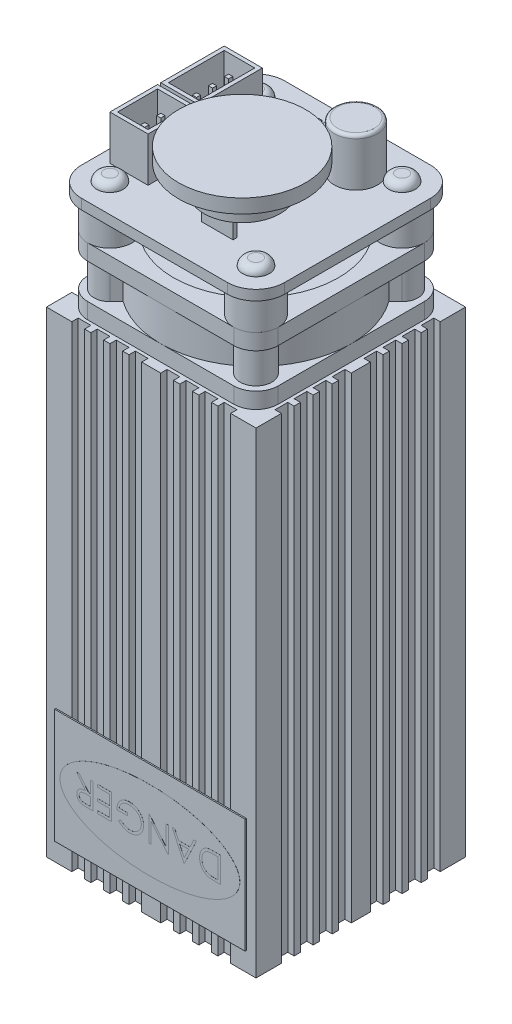
from build123d import *

# Parameters (mm, degrees)
SKETCH1_R              = 8
SKETCH1_R_2            = 2.5
BOSS_EXTRUDE1_DEPTH    = 5.5
SKETCH2_R              = 4
BOSS_EXTRUDE2_DEPTH    = 2
SKETCH3_R              = 9
BOSS_EXTRUDE3_DEPTH    = 75
SKETCH4_R              = 9
BOSS_EXTRUDE4_DEPTH    = 2
FILLET1_R              = 0.5
BOSS_EXTRUDE5_DEPTH    = 2.5
BOSS_EXTRUDE6_DEPTH    = 5.5
BOSS_EXTRUDE7_DEPTH    = 2.5
SKETCH9_R              = 3.5
BOSS_EXTRUDE8_DEPTH    = 5
BOSS_EXTRUDE8_2_DEPTH  = 5
BOSS_EXTRUDE8_3_DEPTH  = 5
BOSS_EXTRUDE8_4_DEPTH  = 5
BOSS_EXTRUDE9_DEPTH    = 1.6
SKETCH11_R             = 13
CUT_EXTRUDE1_DEPTH     = 1.6
SKETCH12_W             = 6
SKETCH12_H             = 10
SKETCH12_W_2           = 4.8
SKETCH12_H_2           = 8.8
SKETCH12_H_3           = 7.5
SKETCH12_H_4           = 6.3
BOSS_EXTRUDE10_DEPTH   = 7
SKETCH13_W             = 0.65
SKETCH13_H             = 0.65
BOSS_EXTRUDE11_DEPTH   = 5.5
SKETCH14_R             = 3.4
BOSS_EXTRUDE12_DEPTH   = 7.5
FILLET2_R              = 0.5
SKETCH15_W             = 5.8
SKETCH15_H             = 5
BOSS_EXTRUDE13_DEPTH   = 2.5
SKETCH16_W             = 0.5
SKETCH16_H             = 3.5
BOSS_EXTRUDE14_DEPTH   = 0.6
BOSS_EXTRUDE14_2_DEPTH = 0.6
BOSS_EXTRUDE14_3_DEPTH = 0.6
BOSS_EXTRUDE14_4_DEPTH = 0.6
BOSS_EXTRUDE14_5_DEPTH = 0.6
SKETCH16_W_2           = 4.454418676
SKETCH16_H_2           = 1.300822907
BOSS_EXTRUDE14_6_DEPTH = 0.6
SKETCH17_R             = 2.1
BOSS_EXTRUDE15_DEPTH   = 1.15
FILLET3_R              = 1.15
SKETCH19_W             = 5
SKETCH19_H             = 0.6
SKETCH19_W_2           = 0.6
SKETCH19_H_2           = 1.4
BOSS_EXTRUDE16_DEPTH   = 3
SKETCH20_R             = 6.011955252
BOSS_EXTRUDE17_DEPTH   = 4
SKETCH21_R             = 10
BOSS_EXTRUDE18_DEPTH   = 2.2
SKETCH22_R             = 1.35
CUT_EXTRUDE3_DEPTH     = 5
SKETCH23_W             = 30
SKETCH23_H             = 18
BOSS_EXTRUDE19_DEPTH   = 0.2
SKETCH24_RX            = 14.161981517
SKETCH24_RY            = 6.24923691
BOSS_EXTRUDE20_DEPTH   = 0.01
BOSS_EXTRUDE21_DEPTH   = 0.01


# Read off the part's stored shape, not the designer's step: CirPattern1
with BuildPart() as part:
    # Sketch1 → Boss-Extrude1 (new body)
    with BuildSketch(Plane(origin=(0, 0, 0), x_dir=(1, 0, 0), z_dir=(0, 1, 0))):
        with Locations(Location((0, 0, 0), (0, 0, 270))):
            Circle(SKETCH1_R)
        with Locations(Location((0, 0, 0), (0, 0, 270))):
            Circle(SKETCH1_R_2, mode=Mode.SUBTRACT)
    extrude(amount=BOSS_EXTRUDE1_DEPTH)

    # Sketch2 → Boss-Extrude2 (add)
    with BuildSketch(Plane(origin=(0, 5.5, 0), x_dir=(1, 0, 0), z_dir=(0, 1, 0))):
        with Locations(Location((0, 0, 0), (0, 0, 270))):
            Circle(SKETCH2_R)
    extrude(amount=BOSS_EXTRUDE2_DEPTH)


with BuildPart() as body_2:
    # Sketch3 → Boss-Extrude3 (new body)
    with BuildSketch(Plane(origin=(0, 7.5, 0), x_dir=(1, 0, 0), z_dir=(0, 1, 0))):
        Polygon((-16.5, 10.5), (-16.5, 9.5), (-15.5, 9.5), (-15.5, 7.5), (-16.5, 7.5), (-16.5, 6.5), (-15.5, 6.5), (-15.5, 4.5), (-16.5, 4.5), (-16.5, 3.5), (-15.5, 3.5), (-15.5, 1.5), (-16.5, 1.5), (-16.5, -1.5), (-15.5, -1.5), (-15.5, -3.5), (-16.5, -3.5), (-16.5, -4.5), (-15.5, -4.5), (-15.5, -6.5), (-16.5, -6.5), (-16.5, -7.5), (-15.5, -7.5), (-15.5, -9.5), (-16.5, -9.5), (-16.5, -10.5), (-15.5, -10.5), (-15.5, -12.5), (-16.5, -12.5), (-16.5, -16.5), (-12.5, -16.5), (-12.5, -15.5), (-10.5, -15.5), (-10.5, -16.5), (-9.5, -16.5), (-9.5, -15.5), (-7.5, -15.5), (-7.5, -16.5), (-6.5, -16.5), (-6.5, -15.5), (-4.5, -15.5), (-4.5, -16.5), (-3.5, -16.5), (-3.5, -15.5), (-1.5, -15.5), (-1.5, -16.5), (1.5, -16.5), (1.5, -15.5), (3.5, -15.5), (3.5, -16.5), (4.5, -16.5), (4.5, -15.5), (6.5, -15.5), (6.5, -16.5), (7.5, -16.5), (7.5, -15.5), (9.5, -15.5), (9.5, -16.5), (10.5, -16.5), (10.5, -15.5), (12.5, -15.5), (12.5, -16.5), (16.5, -16.5), (16.5, -12.5), (15.5, -12.5), (15.5, -10.5), (16.5, -10.5), (16.5, -9.5), (15.5, -9.5), (15.5, -7.5), (16.5, -7.5), (16.5, -6.5), (15.5, -6.5), (15.5, -4.5), (16.5, -4.5), (16.5, -3.5), (15.5, -3.5), (15.5, -1.5), (16.5, -1.5), (16.5, 1.5), (15.5, 1.5), (15.5, 3.5), (16.5, 3.5), (16.5, 4.5), (15.5, 4.5), (15.5, 6.5), (16.5, 6.5), (16.5, 7.5), (15.5, 7.5), (15.5, 9.5), (16.5, 9.5), (16.5, 10.5), (15.5, 10.5), (15.5, 12.5), (16.5, 12.5), (16.5, 16.5), (-16.5, 16.5), (-16.5, 12.5), (-15.5, 12.5), (-15.5, 10.5), align=None)
        with BuildLine():
            Line((13.5, 10.767949192), (13.5, 1.5))
            Line((13.5, 1.5), (11.9058809, 1.5))
            ThreePointArc((11.9058809, 1.5), (8.485281374, 8.485281374), (1.5, 11.9058809))
            Line((1.5, 11.9058809), (1.5, 13.5))
            Line((1.5, 13.5), (10.767949192, 13.5))
            ThreePointArc((10.767949192, 13.5), (10.534687206, 12.870871435), (10.522628007, 12.2))
            Line((10.522628007, 12.2), (11.546060799, 12.2))
            ThreePointArc((11.546060799, 12.2), (13.207106781, 13.207106781), (12.2, 11.546060799))
            Line((12.2, 11.546060799), (12.2, 10.522628007))
            ThreePointArc((12.2, 10.522628007), (12.870871435, 10.534687206), (13.5, 10.767949192))
        make_face(mode=Mode.SUBTRACT)
        with BuildLine():
            ThreePointArc((-1.5, 11.9058809), (-8.485281374, 8.485281374), (-11.9058809, 1.5))
            Line((-11.9058809, 1.5), (-13.5, 1.5))
            Line((-13.5, 1.5), (-13.5, 10.767949192))
            ThreePointArc((-13.5, 10.767949192), (-12.870871435, 10.534687206), (-12.2, 10.522628007))
            Line((-12.2, 10.522628007), (-12.2, 11.546060799))
            ThreePointArc((-12.2, 11.546060799), (-13.207106781, 13.207106781), (-11.546060799, 12.2))
            Line((-11.546060799, 12.2), (-10.522628007, 12.2))
            ThreePointArc((-10.522628007, 12.2), (-10.534687206, 12.870871435), (-10.767949192, 13.5))
            Line((-10.767949192, 13.5), (-1.5, 13.5))
            Line((-1.5, 13.5), (-1.5, 11.9058809))
        make_face(mode=Mode.SUBTRACT)
        with BuildLine():
            ThreePointArc((-11.9058809, -1.5), (-8.485281374, -8.485281374), (-1.5, -11.9058809))
            Line((-1.5, -11.9058809), (-1.5, -13.5))
            Line((-1.5, -13.5), (-10.767949192, -13.5))
            ThreePointArc((-10.767949192, -13.5), (-10.534687206, -12.870871435), (-10.522628007, -12.2))
            Line((-10.522628007, -12.2), (-11.546060799, -12.2))
            ThreePointArc((-11.546060799, -12.2), (-13.207106781, -13.207106781), (-12.2, -11.546060799))
            Line((-12.2, -11.546060799), (-12.2, -10.522628007))
            ThreePointArc((-12.2, -10.522628007), (-12.870871435, -10.534687206), (-13.5, -10.767949192))
            Line((-13.5, -10.767949192), (-13.5, -1.5))
            Line((-13.5, -1.5), (-11.9058809, -1.5))
        make_face(mode=Mode.SUBTRACT)
        with BuildLine():
            ThreePointArc((1.5, -11.9058809), (8.485281374, -8.485281374), (11.9058809, -1.5))
            Line((11.9058809, -1.5), (13.5, -1.5))
            Line((13.5, -1.5), (13.5, -10.767949192))
            ThreePointArc((13.5, -10.767949192), (12.870871435, -10.534687206), (12.2, -10.522628007))
            Line((12.2, -10.522628007), (12.2, -11.546060799))
            ThreePointArc((12.2, -11.546060799), (13.207106781, -13.207106781), (11.546060799, -12.2))
            Line((11.546060799, -12.2), (10.522628007, -12.2))
            ThreePointArc((10.522628007, -12.2), (10.534687206, -12.870871435), (10.767949192, -13.5))
            Line((10.767949192, -13.5), (1.5, -13.5))
            Line((1.5, -13.5), (1.5, -11.9058809))
        make_face(mode=Mode.SUBTRACT)
        with Locations(Location((0, 0, 0), (0, 0, 270))):
            Circle(SKETCH3_R, mode=Mode.SUBTRACT)
    extrude(amount=BOSS_EXTRUDE3_DEPTH)

    # Sketch5 → Boss-Extrude5 (add)
    with BuildSketch(Plane(origin=(0, 82.5, 0), x_dir=(1, 0, 0), z_dir=(0, 1, 0))):
        with BuildLine():
            Line((-11.5, -15), (11.5, -15))
            ThreePointArc((11.5, -15), (13.974873734, -13.974873734), (15, -11.5))
            Line((15, -11.5), (15, 11.5))
            ThreePointArc((15, 11.5), (13.974873734, 13.974873734), (11.5, 15))
            Line((11.5, 15), (-11.5, 15))
            ThreePointArc((-11.5, 15), (-13.974873734, 13.974873734), (-15, 11.5))
            Line((-15, 11.5), (-15, -11.5))
            ThreePointArc((-15, -11.5), (-13.974873734, -13.974873734), (-11.5, -15))
        make_face()
    extrude(amount=BOSS_EXTRUDE5_DEPTH)

    # Sketch6 → Boss-Extrude6 (add)
    with BuildSketch(Plane(origin=(0, 85, 0), x_dir=(1, 0, 0), z_dir=(0, 1, 0))):
        with BuildLine():
            Line((-13.267766953, 9.732233047), (-12.226017285, 8.690483379))
            ThreePointArc((-12.226017285, 8.690483379), (-15, 0), (-12.226017285, -8.690483379))
            Line((-12.226017285, -8.690483379), (-13.267766953, -9.732233047))
            ThreePointArc((-13.267766953, -9.732233047), (-13.267766953, -13.267766953), (-9.732233047, -13.267766953))
            Line((-9.732233047, -13.267766953), (-8.690483379, -12.226017285))
            ThreePointArc((-8.690483379, -12.226017285), (0, -15), (8.690483379, -12.226017285))
            Line((8.690483379, -12.226017285), (9.732233047, -13.267766953))
            ThreePointArc((9.732233047, -13.267766953), (13.267766953, -13.267766953), (13.267766953, -9.732233047))
            Line((13.267766953, -9.732233047), (12.226017285, -8.690483379))
            ThreePointArc((12.226017285, -8.690483379), (15, 0), (12.226017285, 8.690483379))
            Line((12.226017285, 8.690483379), (13.267766953, 9.732233047))
            ThreePointArc((13.267766953, 9.732233047), (13.267766953, 13.267766953), (9.732233047, 13.267766953))
            Line((9.732233047, 13.267766953), (8.690483379, 12.226017285))
            ThreePointArc((8.690483379, 12.226017285), (0, 15), (-8.690483379, 12.226017285))
            Line((-8.690483379, 12.226017285), (-9.732233047, 13.267766953))
            ThreePointArc((-9.732233047, 13.267766953), (-13.267766953, 13.267766953), (-13.267766953, 9.732233047))
        make_face()
    extrude(amount=BOSS_EXTRUDE6_DEPTH)

    # Sketch22 → Cut-Extrude3 (cut)
    with BuildSketch(Plane(origin=(0, 0, -16.5), x_dir=(-1, 0, 0), z_dir=(0, 0, -1))):
        with Locations((0, 15.5)):
            Circle(SKETCH22_R)
        with Locations((0, 23)):
            Circle(SKETCH22_R)
        with Locations((0, 43)):
            Circle(SKETCH22_R)
        with Locations((0, 55.5)):
            Circle(SKETCH22_R)
    extrude(amount=-CUT_EXTRUDE3_DEPTH, mode=Mode.SUBTRACT)


with BuildPart() as body_3:
    # Sketch4 → Boss-Extrude4 (new body)
    with BuildSketch(Plane(origin=(0, 7.5, 0), x_dir=(1, 0, 0), z_dir=(0, 1, 0))):
        with Locations(Location((0, 0, 0), (0, 0, 270))):
            Circle(SKETCH4_R)
    extrude(amount=BOSS_EXTRUDE4_DEPTH)

    # Fillet1
    fillet1_edges = [body_3.edges().sort_by_distance(p)[0] for p in [
        (0, 7.5, -9),
    ]]
    fillet(fillet1_edges, radius=FILLET1_R)


with BuildPart() as body_4:
    # Sketch7 → Boss-Extrude7 (new body)
    with BuildSketch(Plane(origin=(0, 90.5, 0), x_dir=(1, 0, 0), z_dir=(0, 1, 0))):
        with BuildLine():
            Line((-11.5, -15), (11.5, -15))
            ThreePointArc((11.5, -15), (13.974873734, -13.974873734), (15, -11.5))
            Line((15, -11.5), (15, 11.5))
            ThreePointArc((15, 11.5), (13.974873734, 13.974873734), (11.5, 15))
            Line((11.5, 15), (-11.5, 15))
            ThreePointArc((-11.5, 15), (-13.974873734, 13.974873734), (-15, 11.5))
            Line((-15, 11.5), (-15, -11.5))
            ThreePointArc((-15, -11.5), (-13.974873734, -13.974873734), (-11.5, -15))
        make_face()
    extrude(amount=BOSS_EXTRUDE7_DEPTH)

    # Sketch11 → Cut-Extrude1 (cut)
    with BuildSketch(Plane(origin=(0, 93, 0), x_dir=(1, 0, 0), z_dir=(0, 1, 0))):
        with Locations(Location((0, 0, 0), (0, 0, 270))):
            Circle(SKETCH11_R)
    extrude(amount=-CUT_EXTRUDE1_DEPTH, mode=Mode.SUBTRACT)


with BuildPart() as body_5:
    # Sketch9 → Boss-Extrude8 (new body)
    with BuildSketch(Plane(origin=(0, 93, 0), x_dir=(1, 0, 0), z_dir=(0, 1, 0))):
        with Locations(Location((-11.5, 11.5, 0), (0, 0, 270))):
            Circle(SKETCH9_R)
    extrude(amount=BOSS_EXTRUDE8_DEPTH)


with BuildPart() as body_6:
    # Sketch9 → Boss-Extrude8 2 (new body)
    with BuildSketch(Plane(origin=(0, 93, 0), x_dir=(1, 0, 0), z_dir=(0, 1, 0))):
        with Locations(Location((11.5, 11.5, 0), (0, 0, 270))):
            Circle(SKETCH9_R)
    extrude(amount=BOSS_EXTRUDE8_2_DEPTH)


with BuildPart() as body_7:
    # Sketch9 → Boss-Extrude8 3 (new body)
    with BuildSketch(Plane(origin=(0, 93, 0), x_dir=(1, 0, 0), z_dir=(0, 1, 0))):
        with Locations(Location((11.5, -11.5, 0), (0, 0, 270))):
            Circle(SKETCH9_R)
    extrude(amount=BOSS_EXTRUDE8_3_DEPTH)


with BuildPart() as body_8:
    # Sketch9 → Boss-Extrude8 4 (new body)
    with BuildSketch(Plane(origin=(0, 93, 0), x_dir=(1, 0, 0), z_dir=(0, 1, 0))):
        with Locations(Location((-11.5, -11.5, 0), (0, 0, 270))):
            Circle(SKETCH9_R)
    extrude(amount=BOSS_EXTRUDE8_4_DEPTH)


with BuildPart() as body_9:
    # Sketch10 → Boss-Extrude9 (new body)
    with BuildSketch(Plane(origin=(0, 98, 0), x_dir=(1, 0, 0), z_dir=(0, 1, 0))):
        with BuildLine():
            Line((11.5, 16), (-11.5, 16))
            ThreePointArc((-11.5, 16), (-14.681980515, 14.681980515), (-16, 11.5))
            Line((-16, 11.5), (-16, -11.5))
            ThreePointArc((-16, -11.5), (-14.681980515, -14.681980515), (-11.5, -16))
            Line((-11.5, -16), (11.5, -16))
            ThreePointArc((11.5, -16), (14.681980515, -14.681980515), (16, -11.5))
            Line((16, -11.5), (16, 11.5))
            ThreePointArc((16, 11.5), (14.681980515, 14.681980515), (11.5, 16))
        make_face()
    extrude(amount=BOSS_EXTRUDE9_DEPTH)

    # Sketch12 → Boss-Extrude10 (add)
    # profile 1 of 2: a face of its own
    with BuildSketch(Plane(origin=(0, 99.6, 0), x_dir=(1, 0, 0), z_dir=(0, 1, 0))):
        with Locations((-11, 4)):
            Rectangle(SKETCH12_W, SKETCH12_H)
        with Locations((-11, 4)):
            Rectangle(SKETCH12_W_2, SKETCH12_H_2, mode=Mode.SUBTRACT)
    # profile 2 of 2: a face of its own
    with BuildSketch(Plane(origin=(0, 99.6, 0), x_dir=(1, 0, 0), z_dir=(0, 1, 0))):
        with Locations((-11, -5.25)):
            Rectangle(SKETCH12_W, SKETCH12_H_3)
        with Locations((-11, -5.25)):
            Rectangle(SKETCH12_W_2, SKETCH12_H_4, mode=Mode.SUBTRACT)
    extrude(amount=BOSS_EXTRUDE10_DEPTH)

    # Sketch13 → Boss-Extrude11 (add)
    with BuildSketch(Plane(origin=(0, 99.6, 0), x_dir=(1, 0, 0), z_dir=(0, 1, 0))):
        with Locations((-11, 6.69)):
            Rectangle(SKETCH13_W, SKETCH13_H)
        with Locations((-11, 4.16)):
            Rectangle(SKETCH13_W, SKETCH13_H)
        with Locations((-11, 1.63)):
            Rectangle(SKETCH13_W, SKETCH13_H)
        with Locations((-11, -3.985)):
            Rectangle(SKETCH13_W, SKETCH13_H)
        with Locations((-11, -6.515)):
            Rectangle(SKETCH13_W, SKETCH13_H)
    extrude(amount=BOSS_EXTRUDE11_DEPTH)

    # Sketch14 → Boss-Extrude12 (add)
    with BuildSketch(Plane(origin=(0, 99.6, 0), x_dir=(1, 0, 0), z_dir=(0, 1, 0))):
        with Locations(Location((6.6343548, 9.108581093, 0), (0, 0, 270))):
            Circle(SKETCH14_R)
    extrude(amount=BOSS_EXTRUDE12_DEPTH)

    # Fillet2
    fillet2_edges = [body_9.edges().sort_by_distance(p)[0] for p in [
        (6.6343548, 107.1, -12.508581093),
    ]]
    fillet(fillet2_edges, radius=FILLET2_R)

    # Sketch17 → Boss-Extrude15 (add)
    with BuildSketch(Plane(origin=(0, 99.6, 0), x_dir=(1, 0, 0), z_dir=(0, 1, 0))):
        with Locations(Location((-11.5, -11.5, 0), (0, 0, 270))):
            Circle(SKETCH17_R)
    extrude(amount=BOSS_EXTRUDE15_DEPTH)

    # Fillet3
    fillet3_edges = [body_9.edges().sort_by_distance(p)[0] for p in [
        (-11.5, 100.75, 9.4),
    ]]
    fillet(fillet3_edges, radius=FILLET3_R - 0.0001)  # a hair under: the kernel refuses the full size

    # CirPattern1 outline → CirPattern1 (revolve)
    with BuildSketch(Plane(origin=(-11.5, 0, -11.5), x_dir=(1, 0, 0), z_dir=(0, 0, 1))):
        with BuildLine():
            Line((0.95, 100.75), (0, 100.75))
            Line((0, 100.75), (0, 99.6))
            Line((0, 99.6), (2.1, 99.6))
            ThreePointArc((2.1, 99.6), (1.763172798, 100.413172798), (0.95, 100.75))
        make_face()
    revolve(axis=Axis((-11.5, 0, -11.5), (0, 1, 0)))

    # CirPattern1 2 outline → CirPattern1 2 (revolve)
    with BuildSketch(Plane(origin=(11.5, 0, -11.5), x_dir=(1, 0, 0), z_dir=(0, 0, 1))):
        with BuildLine():
            Line((0.95, 100.75), (0, 100.75))
            Line((0, 100.75), (0, 99.6))
            Line((0, 99.6), (2.1, 99.6))
            ThreePointArc((2.1, 99.6), (1.763172798, 100.413172798), (0.95, 100.75))
        make_face()
    revolve(axis=Axis((11.5, 0, -11.5), (0, 1, 0)))

    # CirPattern1 3 outline → CirPattern1 3 (revolve)
    with BuildSketch(Plane(origin=(11.5, 0, 11.5), x_dir=(1, 0, 0), z_dir=(0, 0, 1))):
        with BuildLine():
            Line((0.95, 100.75), (0, 100.75))
            Line((0, 100.75), (0, 99.6))
            Line((0, 99.6), (2.1, 99.6))
            ThreePointArc((2.1, 99.6), (1.763172798, 100.413172798), (0.95, 100.75))
        make_face()
    revolve(axis=Axis((11.5, 0, 11.5), (0, 1, 0)))

    # Sketch19 → Boss-Extrude16 (add)
    with BuildSketch(Plane(origin=(0, 99.6, 0), x_dir=(1, 0, 0), z_dir=(0, 1, 0))):
        with Locations((3.631562842, -1.508021858)):
            Rectangle(SKETCH19_W, SKETCH19_H)
        with Locations((3.631562842, -9.448218579)):
            Rectangle(SKETCH19_W, SKETCH19_H)
        with Locations((-1.193278944, -3.51449095)):
            Rectangle(SKETCH19_W_2, SKETCH19_H_2)
        with Locations((-1.193278944, -6.885189757)):
            Rectangle(SKETCH19_W_2, SKETCH19_H_2)
    extrude(amount=BOSS_EXTRUDE16_DEPTH)

    # Sketch20 → Boss-Extrude17 (add)
    with BuildSketch(Plane(origin=(0, 102.6, 0), x_dir=(1, 0, 0), z_dir=(0, 1, 0))):
        with Locations(Location((3.262251366, -5.447344262, 0), (0, 0, 270))):
            Circle(SKETCH20_R)
    extrude(amount=BOSS_EXTRUDE17_DEPTH)

    # Sketch21 → Boss-Extrude18 (add)
    with BuildSketch(Plane(origin=(0, 106.6, 0), x_dir=(1, 0, 0), z_dir=(0, 1, 0))):
        with Locations(Location((3.262251366, -5.447344262, 0), (0, 0, 270))):
            Circle(SKETCH21_R)
    extrude(amount=BOSS_EXTRUDE18_DEPTH)


with BuildPart() as body_10:
    # Sketch15 → Boss-Extrude13 (new body)
    with BuildSketch(Plane(origin=(0, 99.6, 0), x_dir=(1, 0, 0), z_dir=(0, 1, 0))):
        with Locations((-2.886204419, 6.964801259)):
            Rectangle(SKETCH15_W, SKETCH15_H)
    extrude(amount=BOSS_EXTRUDE13_DEPTH)


with BuildPart() as body_11:
    # Sketch16 → Boss-Extrude14 (new body)
    with BuildSketch(Plane(origin=(0, 99.6, 0), x_dir=(1, 0, 0), z_dir=(0, 1, 0))):
        with Locations((-4.847374416, 11.214801259)):
            Rectangle(SKETCH16_W, SKETCH16_H)
    extrude(amount=BOSS_EXTRUDE14_DEPTH)


with BuildPart() as body_12:
    # Sketch16 → Boss-Extrude14 2 (new body)
    with BuildSketch(Plane(origin=(0, 99.6, 0), x_dir=(1, 0, 0), z_dir=(0, 1, 0))):
        with Locations((-3.847374416, 11.214801259)):
            Rectangle(SKETCH16_W, SKETCH16_H)
    extrude(amount=BOSS_EXTRUDE14_2_DEPTH)


with BuildPart() as body_13:
    # Sketch16 → Boss-Extrude14 3 (new body)
    with BuildSketch(Plane(origin=(0, 99.6, 0), x_dir=(1, 0, 0), z_dir=(0, 1, 0))):
        with Locations((-2.847374416, 11.214801259)):
            Rectangle(SKETCH16_W, SKETCH16_H)
    extrude(amount=BOSS_EXTRUDE14_3_DEPTH)


with BuildPart() as body_14:
    # Sketch16 → Boss-Extrude14 4 (new body)
    with BuildSketch(Plane(origin=(0, 99.6, 0), x_dir=(1, 0, 0), z_dir=(0, 1, 0))):
        with Locations((-1.847374416, 11.214801259)):
            Rectangle(SKETCH16_W, SKETCH16_H)
    extrude(amount=BOSS_EXTRUDE14_4_DEPTH)


with BuildPart() as body_15:
    # Sketch16 → Boss-Extrude14 5 (new body)
    with BuildSketch(Plane(origin=(0, 99.6, 0), x_dir=(1, 0, 0), z_dir=(0, 1, 0))):
        with Locations((-0.847374416, 11.214801259)):
            Rectangle(SKETCH16_W, SKETCH16_H)
    extrude(amount=BOSS_EXTRUDE14_5_DEPTH)


with BuildPart() as body_16:
    # Sketch16 → Boss-Extrude14 6 (new body)
    with BuildSketch(Plane(origin=(0, 99.6, 0), x_dir=(1, 0, 0), z_dir=(0, 1, 0))):
        with Locations((-2.870165078, 3.814389806)):
            Rectangle(SKETCH16_W_2, SKETCH16_H_2)
    extrude(amount=BOSS_EXTRUDE14_6_DEPTH)


with BuildPart() as body_17:
    # Sketch23 → Boss-Extrude19 (new body)
    with BuildSketch(Plane.XY.offset(16.5)):
        with Locations((0, 19.5)):
            Rectangle(SKETCH23_W, SKETCH23_H)
    extrude(amount=BOSS_EXTRUDE19_DEPTH)

    # Sketch24 → Boss-Extrude20 (add)
    with BuildSketch(Plane.XY.offset(16.7)):
        with Locations(Location((0, 19.5), (0, 0, 0))):
            Ellipse(SKETCH24_RX, SKETCH24_RY)
    extrude(amount=BOSS_EXTRUDE20_DEPTH)

    # Sketch25 → Boss-Extrude21 (add)
    # profile 1 of 6: a face of its own
    with BuildSketch(Plane.XY.offset(16.71)):
        with BuildLine():
            Line((-8.980989234, 17.666240127), (-9.781470003, 17.666240127))
            add(Edge.make_bspline(
                [(-9.781470003, 17.666240127), (-9.834888436, 17.666417939), (-9.937457744, 17.666759359), (-10.084398624, 17.668663088), (-10.217915307, 17.674119495), (-10.33793798, 17.678815018), (-10.444464443, 17.687377237), (-10.537821347, 17.695560834), (-10.617578715, 17.706273589), (-10.665859688, 17.716222644), (-10.687720003, 17.720727306)],
                knots=[0, 0, 0, 0, 1.410062039, 2.707475311, 3.878576406, 4.937260626, 5.877586885, 6.699081471, 7.410979367, 8, 8, 8, 8], degree=3))
            add(Edge.make_bspline(
                [(-10.687720003, 17.720727306), (-10.716985209, 17.727957094), (-10.774891315, 17.74226244), (-10.858255671, 17.772513599), (-10.937726986, 17.807464603), (-11.013014234, 17.848829401), (-11.084097689, 17.895909496), (-11.150970186, 17.948894153), (-11.212735099, 18.008237341), (-11.271589927, 18.071480833), (-11.322981434, 18.141378172), (-11.369247424, 18.214382253), (-11.408086137, 18.291898587), (-11.43864787, 18.3735362), (-11.464268666, 18.458494267), (-11.481488232, 18.547612289), (-11.49221288, 18.640600323), (-11.493272475, 18.703870364), (-11.493809747, 18.735951665)],
                knots=[0, 0, 0, 0, 1.027276577, 2.032638556, 3.019345632, 3.985365262, 4.957888996, 5.923693931, 6.890056973, 7.876427719, 8.865527834, 9.843495157, 10.821038291, 11.815616373, 12.812734995, 13.843357168, 14.906466538, 16, 16, 16, 16], degree=3))
            add(Edge.make_bspline(
                [(-11.493809747, 18.735951665), (-11.492130936, 18.789248989), (-11.48885514, 18.893245872), (-11.458311555, 19.044171737), (-11.408283473, 19.184962658), (-11.339334372, 19.315422702), (-11.25157103, 19.433077582), (-11.146099451, 19.536068179), (-11.023458269, 19.62304843), (-10.908751349, 19.682724549), (-10.807377196, 19.721122721), (-10.723674716, 19.748275444), (-10.632300129, 19.76890056), (-10.534564341, 19.787645909), (-10.429712432, 19.801950116), (-10.317955548, 19.812108822), (-10.199014178, 19.818640947), (-10.117483021, 19.819595318), (-10.075540516, 19.82008628)],
                knots=[0, 0, 0, 0, 1.260402266, 2.459371274, 3.627181936, 4.786749125, 5.93865593, 7.087644312, 8.261344208, 9.485713728, 10.136162886, 10.825977872, 11.566646758, 12.35154167, 13.181268117, 14.0701832, 15.007234106, 16, 16, 16, 16], degree=3))
            Line((-10.075540516, 19.82008628), (-11.545091798, 21.666240127))
            Line((-11.545091798, 21.666240127), (-11.101181542, 21.666240127))
            Line((-11.101181542, 21.666240127), (-9.63163026, 19.82008628))
            Line((-9.63163026, 19.82008628), (-9.339963593, 19.82008628))
            Line((-9.339963593, 19.82008628), (-9.339963593, 21.666240127))
            Line((-9.339963593, 21.666240127), (-8.980989234, 21.666240127))
            Line((-8.980989234, 21.666240127), (-8.980989234, 17.666240127))
        make_face()
        with BuildLine():
            Line((-9.339963593, 18.076496537), (-9.339963593, 19.40982987))
            Line((-9.339963593, 19.40982987), (-10.072335388, 19.415438845))
            add(Edge.make_bspline(
                [(-10.072335388, 19.415438845), (-10.106529722, 19.415453981), (-10.172808082, 19.415483319), (-10.268694498, 19.410918886), (-10.357974824, 19.405726922), (-10.440306449, 19.397783478), (-10.515729856, 19.387552354), (-10.584195226, 19.374734636), (-10.645853858, 19.359864617), (-10.717536877, 19.336614196), (-10.798502965, 19.301366425), (-10.884680474, 19.246711692), (-10.960040237, 19.180614848), (-11.02269356, 19.104078249), (-11.07301678, 19.019566027), (-11.107970739, 18.928990817), (-11.131005195, 18.833779722), (-11.133543937, 18.768405875), (-11.134835388, 18.735150383)],
                knots=[0, 0, 0, 0, 1.146399208, 2.222048177, 3.218135709, 4.144938032, 4.994811973, 5.769438708, 6.479732432, 7.119818093, 8.294689872, 9.430121864, 10.527913442, 11.641375077, 12.733452768, 13.811150417, 14.886538365, 16, 16, 16, 16], degree=3))
            add(Edge.make_bspline(
                [(-11.134835388, 18.735150383), (-11.133478546, 18.702976579), (-11.13078978, 18.63921984), (-11.108337498, 18.546091688), (-11.071676476, 18.457539038), (-11.021496947, 18.374780432), (-10.959043141, 18.30021376), (-10.886298523, 18.236608282), (-10.804974936, 18.183766663), (-10.729582679, 18.148901635), (-10.661703096, 18.128386998), (-10.603038477, 18.113495446), (-10.536174547, 18.103066077), (-10.461898285, 18.093473844), (-10.379883401, 18.085350693), (-10.290079915, 18.079958945), (-10.192552038, 18.076736288), (-10.124955564, 18.076578314), (-10.089963593, 18.076496537)],
                knots=[0, 0, 0, 0, 1.100596872, 2.180981401, 3.259506136, 4.371595435, 5.481727359, 6.576991111, 7.667816242, 8.793363246, 9.406619729, 10.09427138, 10.864108636, 11.721733836, 12.6590937, 13.685439239, 14.801845161, 16, 16, 16, 16], degree=3))
            Line((-10.089963593, 18.076496537), (-9.339963593, 18.076496537))
        make_face(mode=Mode.SUBTRACT)
    # profile 2 of 6: a face of its own
    with BuildSketch(Plane.XY.offset(16.71)):
        Polygon((-6.00663026, 17.666240127), (-8.263040516, 17.666240127), (-8.263040516, 18.076496537), (-6.365604619, 18.076496537), (-6.365604619, 19.307265768), (-8.263040516, 19.307265768), (-8.263040516, 19.717522178), (-6.365604619, 19.717522178), (-6.365604619, 21.255983716), (-8.263040516, 21.255983716), (-8.263040516, 21.666240127), (-6.00663026, 21.666240127), align=None)
    # profile 3 of 6: a face of its own
    with BuildSketch(Plane.XY.offset(16.71)):
        with BuildLine():
            Line((-4.929707183, 18.348932434), (-4.622014875, 18.640599101))
            add(Edge.make_bspline(
                [(-4.622014875, 18.640599101), (-4.566010117, 18.588292897), (-4.455633381, 18.485205441), (-4.2765421, 18.349959345), (-4.089429686, 18.235004025), (-3.895817373, 18.140559469), (-3.699438736, 18.067144392), (-3.504214477, 18.014061421), (-3.311513305, 17.979922587), (-3.183581119, 17.975912491), (-3.120412311, 17.973932434)],
                knots=[0, 0, 0, 0, 1.091957225, 2.152079168, 3.193085318, 4.218301889, 5.218403563, 6.17723952, 7.099979378, 8, 8, 8, 8], degree=3))
            add(Edge.make_bspline(
                [(-3.120412311, 17.973932434), (-3.081652872, 17.974405825), (-3.004234517, 17.975351378), (-2.889234772, 17.98739152), (-2.775456484, 18.004761796), (-2.663292015, 18.029636194), (-2.552295412, 18.061943832), (-2.4427136, 18.100950486), (-2.334758071, 18.147906177), (-2.228996755, 18.201439963), (-2.125941994, 18.259880898), (-2.029018443, 18.325059846), (-1.937821919, 18.394971056), (-1.852997322, 18.470531399), (-1.773382743, 18.550483262), (-1.700435567, 18.635962665), (-1.632560544, 18.725704435), (-1.572296433, 18.820994955), (-1.51782657, 18.919126703), (-1.47066031, 19.019317441), (-1.430047427, 19.120860545), (-1.397595254, 19.223813255), (-1.371504949, 19.328109833), (-1.353037892, 19.433587323), (-1.342665448, 19.540765413), (-1.340867465, 19.612533226), (-1.339963593, 19.648611921)],
                knots=[0, 0, 0, 0, 1.028307134, 2.053947307, 3.065600992, 4.082111276, 5.100671203, 6.132125737, 7.167228006, 8.222953114, 9.277225349, 10.309459149, 11.320441984, 12.324791754, 13.322338422, 14.312705492, 15.305176196, 16.306142747, 17.302479595, 18.282363326, 19.243345101, 20.20291386, 21.145121196, 22.094978082, 23.042318507, 24, 24, 24, 24], degree=3))
            add(Edge.make_bspline(
                [(-1.339963593, 19.648611921), (-1.340835529, 19.685490609), (-1.342577021, 19.75914728), (-1.353494066, 19.869116911), (-1.374438024, 19.977229111), (-1.400020816, 20.084503803), (-1.436232558, 20.189571768), (-1.478327582, 20.293971688), (-1.529084743, 20.396733294), (-1.587532748, 20.497140291), (-1.652124067, 20.594851875), (-1.723151567, 20.6876669), (-1.800749393, 20.774500661), (-1.883490871, 20.856622707), (-1.972130913, 20.933514439), (-2.067529222, 21.004249131), (-2.168350474, 21.069920535), (-2.274639375, 21.129807204), (-2.385272495, 21.183301338), (-2.498708416, 21.230871864), (-2.615311733, 21.270048154), (-2.734469066, 21.301977441), (-2.856038526, 21.328149202), (-2.980637156, 21.344986325), (-3.107348823, 21.357204417), (-3.192764403, 21.358097754), (-3.235796926, 21.358547819)],
                knots=[0, 0, 0, 0, 0.935896426, 1.86923723, 2.799743935, 3.728471844, 4.66505513, 5.616527375, 6.583419551, 7.570341864, 8.562833498, 9.553750335, 10.533080376, 11.5155245, 12.510142773, 13.507781369, 14.526649666, 15.561487327, 16.601173999, 17.643331812, 18.680652164, 19.71969803, 20.772446191, 21.833473655, 22.9085001, 24, 24, 24, 24], degree=3))
            add(Edge.make_bspline(
                [(-3.235796926, 21.358547819), (-3.287658106, 21.357464181), (-3.389495958, 21.355336283), (-3.53919175, 21.338758142), (-3.68297761, 21.312899326), (-3.820385385, 21.274911814), (-3.95191398, 21.226829106), (-4.077077435, 21.167367541), (-4.196224546, 21.097154732), (-4.308827747, 21.017605108), (-4.412253634, 20.928995125), (-4.506261929, 20.834152171), (-4.588097867, 20.732319487), (-4.658295146, 20.623519237), (-4.718714791, 20.509353466), (-4.766910749, 20.387865391), (-4.804187997, 20.260411972), (-4.819437666, 20.172300105), (-4.82714308, 20.127778588)],
                knots=[0, 0, 0, 0, 1.130234505, 2.219399076, 3.279128566, 4.311639422, 5.322903917, 6.328167287, 7.327698761, 8.334124803, 9.329374007, 10.292761544, 11.24113083, 12.171311216, 13.111441694, 14.052040787, 15.015727358, 16, 16, 16, 16], degree=3))
            Line((-4.82714308, 20.127778588), (-3.493809747, 20.127778588))
            Line((-3.493809747, 20.127778588), (-3.493809747, 19.717522178))
            Line((-3.493809747, 19.717522178), (-5.186117439, 19.717522178))
            add(Edge.make_bspline(
                [(-5.186117439, 19.717522178), (-5.184167898, 19.793987879), (-5.180352294, 19.94364507), (-5.153587819, 20.161896808), (-5.110368948, 20.368035886), (-5.051328592, 20.562279397), (-4.9748997, 20.744352074), (-4.881902525, 20.914438778), (-4.770848672, 21.071440699), (-4.645693882, 21.21663956), (-4.505236787, 21.34615866), (-4.35327265, 21.459994018), (-4.1895504, 21.555882721), (-4.014224906, 21.633894907), (-3.827870125, 21.694779472), (-3.630054834, 21.737946988), (-3.42104729, 21.763809804), (-3.277805374, 21.767114237), (-3.204546926, 21.768804229)],
                knots=[0, 0, 0, 0, 1.140356446, 2.231883559, 3.274166699, 4.278491846, 5.25512956, 6.21435461, 7.1637429, 8.11826594, 9.068280886, 10.0076534, 10.945064095, 11.891975133, 12.864533718, 13.863980011, 14.907571808, 16, 16, 16, 16], degree=3))
            add(Edge.make_bspline(
                [(-3.204546926, 21.768804229), (-3.159392486, 21.768153805), (-3.070333376, 21.766870959), (-2.938800887, 21.75775399), (-2.810895035, 21.743719046), (-2.686634454, 21.722524619), (-2.565562063, 21.696565014), (-2.448282537, 21.66332305), (-2.334349117, 21.624844536), (-2.223585705, 21.581078052), (-2.116997652, 21.530367588), (-2.014110204, 21.474013714), (-1.914354632, 21.412307016), (-1.818410443, 21.344180335), (-1.725777733, 21.270143238), (-1.637053797, 21.19004733), (-1.551741937, 21.104137479), (-1.498301407, 21.043132897), (-1.47137385, 21.012393973)],
                knots=[0, 0, 0, 0, 1.107784379, 2.184907829, 3.233506516, 4.263428166, 5.276301166, 6.270063455, 7.25232949, 8.225834625, 9.190232166, 10.146266622, 11.1027726, 12.066435141, 13.031522626, 14.010570082, 14.99756817, 16, 16, 16, 16], degree=3))
            add(Edge.make_bspline(
                [(-1.47137385, 21.012393973), (-1.432304213, 20.963627512), (-1.354813456, 20.866904064), (-1.255066991, 20.711932699), (-1.170036816, 20.55147343), (-1.10104502, 20.385079569), (-1.047172921, 20.212906754), (-1.008537204, 20.035174993), (-0.985900302, 19.851655415), (-0.982639116, 19.727466541), (-0.980989234, 19.664637562)],
                knots=[0, 0, 0, 0, 1.023165419, 2.029347347, 3.013907458, 3.994755782, 4.975994455, 5.96558838, 6.970761222, 8, 8, 8, 8], degree=3))
            add(Edge.make_bspline(
                [(-0.980989234, 19.664637562), (-0.981599154, 19.617590911), (-0.982811243, 19.524095543), (-0.997444731, 19.385279915), (-1.018565618, 19.248963486), (-1.04915841, 19.115020039), (-1.089410856, 18.984044224), (-1.137752496, 18.855029631), (-1.194374306, 18.728491924), (-1.260449882, 18.60555264), (-1.332372382, 18.486253822), (-1.413248097, 18.374350424), (-1.498584242, 18.267678701), (-1.592469169, 18.169258735), (-1.691384797, 18.075946404), (-1.797791509, 17.990201134), (-1.909943547, 17.910576245), (-2.028746498, 17.838629864), (-2.152315915, 17.773980539), (-2.280385847, 17.717308542), (-2.412909035, 17.670470092), (-2.548894824, 17.630728731), (-2.68937194, 17.601339972), (-2.833321133, 17.580027127), (-2.981492687, 17.565443583), (-3.08164815, 17.564270719), (-3.132431542, 17.563676024)],
                knots=[0, 0, 0, 0, 1.009025537, 2.005226976, 2.991671811, 3.967589759, 4.950148279, 5.929425679, 6.922109907, 7.921964004, 8.922507644, 9.908469609, 10.882248289, 11.851158214, 12.824245259, 13.798023939, 14.780666017, 15.773333703, 16.775582742, 17.771174102, 18.775387309, 19.789283316, 20.80873549, 21.851817535, 22.910773411, 24, 24, 24, 24], degree=3))
            add(Edge.make_bspline(
                [(-3.132431542, 17.563676024), (-3.17384698, 17.564336645), (-3.255968928, 17.565646579), (-3.378165332, 17.574773257), (-3.498232397, 17.589078635), (-3.616772427, 17.609082312), (-3.733334071, 17.635543932), (-3.848270474, 17.66779299), (-3.961364252, 17.705131168), (-4.072480863, 17.749696273), (-4.182375775, 17.800270093), (-4.291657774, 17.8572002), (-4.399954084, 17.921457215), (-4.50745234, 17.993232721), (-4.614830466, 18.07129376), (-4.720390057, 18.15787299), (-4.826679136, 18.249556139), (-4.895024066, 18.315478635), (-4.929707183, 18.348932434)],
                knots=[0, 0, 0, 0, 0.985875312, 1.954874891, 2.915472732, 3.863573565, 4.815313299, 5.759461513, 6.704487138, 7.649063459, 8.607849844, 9.583336382, 10.581114205, 11.603942397, 12.659508253, 13.739925933, 14.853076422, 16, 16, 16, 16], degree=3))
        make_face()
    # profile 4 of 6: a face of its own
    with BuildSketch(Plane.XY.offset(16.71)):
        Polygon((2.916446663, 21.666240127), (2.916446663, 17.666240127), (2.84112615, 17.666240127), (0.198497945, 20.814477306), (0.198497945, 17.666240127), (-0.160476414, 17.666240127), (-0.160476414, 21.666240127), (-0.078745644, 21.666240127), (2.557472304, 18.525214486), (2.557472304, 21.666240127), align=None)
    # profile 5 of 6: a face of its own
    with BuildSketch(Plane.XY.offset(16.71)):
        Polygon((5.377985125, 17.666240127), (3.531831279, 21.666240127), (3.922055638, 21.666240127), (4.513401792, 20.384188845), (6.326703074, 20.384188845), (6.93487615, 21.666240127), (7.326703074, 21.666240127), (5.429267176, 17.666240127), align=None)
        Polygon((5.407632561, 18.445887562), (6.131991535, 19.973932434), (4.702504356, 19.973932434), align=None, mode=Mode.SUBTRACT)
    # profile 6 of 6: a face of its own
    with BuildSketch(Plane.XY.offset(16.71)):
        with BuildLine():
            Line((11.121574868, 21.666240127), (11.121574868, 17.666240127))
            Line((11.121574868, 17.666240127), (10.313882561, 17.666240127))
            add(Edge.make_bspline(
                [(10.313882561, 17.666240127), (10.243632142, 17.666744543), (10.1079087, 17.667719072), (9.911782145, 17.673933409), (9.730573812, 17.684815581), (9.564386606, 17.700972509), (9.412953535, 17.720365351), (9.276517137, 17.745028203), (9.154856305, 17.774033388), (9.080034233, 17.79877221), (9.044651792, 17.810470896)],
                knots=[0, 0, 0, 0, 1.314317071, 2.539253741, 3.67075822, 4.709970291, 5.662644612, 6.526156501, 7.303037452, 8, 8, 8, 8], degree=3))
            add(Edge.make_bspline(
                [(9.044651792, 17.810470896), (8.998367951, 17.828100516), (8.906849833, 17.862959975), (8.77661606, 17.928818043), (8.653599714, 18.003133), (8.538772138, 18.087608629), (8.431880314, 18.181165433), (8.331579313, 18.283046462), (8.240744075, 18.395971596), (8.156241666, 18.516436808), (8.082280134, 18.645538359), (8.017060276, 18.780690361), (7.961372419, 18.921630579), (7.917920932, 19.06938739), (7.882022495, 19.222541647), (7.857935525, 19.382252915), (7.841935519, 19.547590066), (7.840335451, 19.659790897), (7.839523586, 19.716720896)],
                knots=[0, 0, 0, 0, 0.984696416, 1.947063185, 2.89840987, 3.841051395, 4.778753227, 5.721858861, 6.681155121, 7.65838316, 8.646299769, 9.637283673, 10.641736726, 11.657050558, 12.698485921, 13.768600492, 14.86780186, 16, 16, 16, 16], degree=3))
            add(Edge.make_bspline(
                [(7.839523586, 19.716720896), (7.840242891, 19.766162144), (7.841660357, 19.863591286), (7.854372633, 20.007183281), (7.872885222, 20.146504308), (7.901415173, 20.280942623), (7.936472115, 20.411403361), (7.979741321, 20.537268809), (8.031026316, 20.658624513), (8.090502344, 20.774506579), (8.155626168, 20.884633225), (8.226589266, 20.987259564), (8.300961905, 21.083517095), (8.381456591, 21.171231254), (8.465408227, 21.253133487), (8.555672124, 21.325590603), (8.649422013, 21.391966408), (8.749474413, 21.450245183), (8.856650217, 21.502085886), (8.973749008, 21.54586567), (9.100343408, 21.583541436), (9.237272259, 21.613558908), (9.384078889, 21.637754513), (9.541161258, 21.653867544), (9.708225218, 21.66479419), (9.822944755, 21.665748789), (9.881991535, 21.666240127)],
                knots=[0, 0, 0, 0, 1.105894396, 2.179280415, 3.222964075, 4.248423888, 5.251546139, 6.243661943, 7.223682738, 8.196462441, 9.155694589, 10.083899862, 10.986397372, 11.874737962, 12.745335529, 13.607670254, 14.461432187, 15.313100333, 16.195087267, 17.121790994, 18.106827133, 19.14775296, 20.255889161, 21.433815148, 22.679170477, 24, 24, 24, 24], degree=3))
            Line((9.881991535, 21.666240127), (11.121574868, 21.666240127))
        make_face()
        with BuildLine():
            Line((10.762600509, 21.255983716), (10.303465894, 21.255983716))
            add(Edge.make_bspline(
                [(10.303465894, 21.255983716), (10.237490613, 21.255700178), (10.110595986, 21.255154829), (9.928129704, 21.250369454), (9.761410394, 21.242550097), (9.610414383, 21.231607151), (9.475226927, 21.217128733), (9.355565498, 21.200985987), (9.251822346, 21.180874615), (9.189045846, 21.162644947), (9.160036407, 21.154220896)],
                knots=[0, 0, 0, 0, 1.375205317, 2.645023457, 3.804390687, 4.853969522, 5.800190428, 6.637939096, 7.370582563, 8, 8, 8, 8], degree=3))
            add(Edge.make_bspline(
                [(9.160036407, 21.154220896), (9.123523217, 21.141362933), (9.051368955, 21.115954119), (8.947516076, 21.069588614), (8.850609536, 21.014734646), (8.759033801, 20.953400248), (8.673377398, 20.884638356), (8.594036996, 20.808230292), (8.520385903, 20.725060648), (8.453603343, 20.634849182), (8.393203816, 20.538596834), (8.341018823, 20.436410823), (8.297027465, 20.328864579), (8.260935481, 20.216332273), (8.232796109, 20.098746931), (8.212984883, 19.975813473), (8.200708099, 19.847580445), (8.199242696, 19.760285069), (8.198497945, 19.715919614)],
                knots=[0, 0, 0, 0, 0.998420628, 1.972994, 2.929372424, 3.86770908, 4.81360496, 5.759023883, 6.706048443, 7.676227424, 8.651287839, 9.634325482, 10.632389399, 11.645655052, 12.680158286, 13.74837235, 14.855672678, 16, 16, 16, 16], degree=3))
            add(Edge.make_bspline(
                [(8.198497945, 19.715919614), (8.199085185, 19.669138774), (8.200238822, 19.577237399), (8.214714884, 19.442386919), (8.235914492, 19.312709135), (8.266408474, 19.188110683), (8.30580407, 19.06875367), (8.352944093, 18.953963779), (8.410179481, 18.845218247), (8.474975991, 18.74159604), (8.547721941, 18.644666452), (8.628094631, 18.555565064), (8.715246582, 18.474125902), (8.808776138, 18.400219302), (8.909990998, 18.335159589), (9.017178408, 18.277283485), (9.131848247, 18.228108504), (9.211635687, 18.201963151), (9.252183843, 18.188676024)],
                knots=[0, 0, 0, 0, 1.122272916, 2.204715076, 3.251197285, 4.274229216, 5.279697671, 6.265416158, 7.248880903, 8.225321784, 9.195852973, 10.153576302, 11.101466393, 12.055578741, 13.010401466, 13.985536859, 14.976245305, 16, 16, 16, 16], degree=3))
            add(Edge.make_bspline(
                [(9.252183843, 18.188676024), (9.28572801, 18.179400106), (9.357052113, 18.159676961), (9.473440072, 18.138162249), (9.604428814, 18.119185679), (9.750599901, 18.103119348), (9.911786712, 18.091590981), (10.088113212, 18.08293805), (10.279655618, 18.077101899), (10.412435656, 18.076703376), (10.481350509, 18.076496537)],
                knots=[0, 0, 0, 0, 0.674548936, 1.434276114, 2.292660221, 3.240891867, 4.284742987, 5.42552168, 6.663806718, 8, 8, 8, 8], degree=3))
            Line((10.481350509, 18.076496537), (10.762600509, 18.076496537))
            Line((10.762600509, 18.076496537), (10.762600509, 21.255983716))
        make_face(mode=Mode.SUBTRACT)
    extrude(amount=BOSS_EXTRUDE21_DEPTH)


solid = Compound([part.part, body_2.part, body_3.part, body_4.part, body_5.part, body_6.part, body_7.part, body_8.part, body_9.part, body_10.part, body_11.part, body_12.part, body_13.part, body_14.part, body_15.part, body_16.part, body_17.part])
